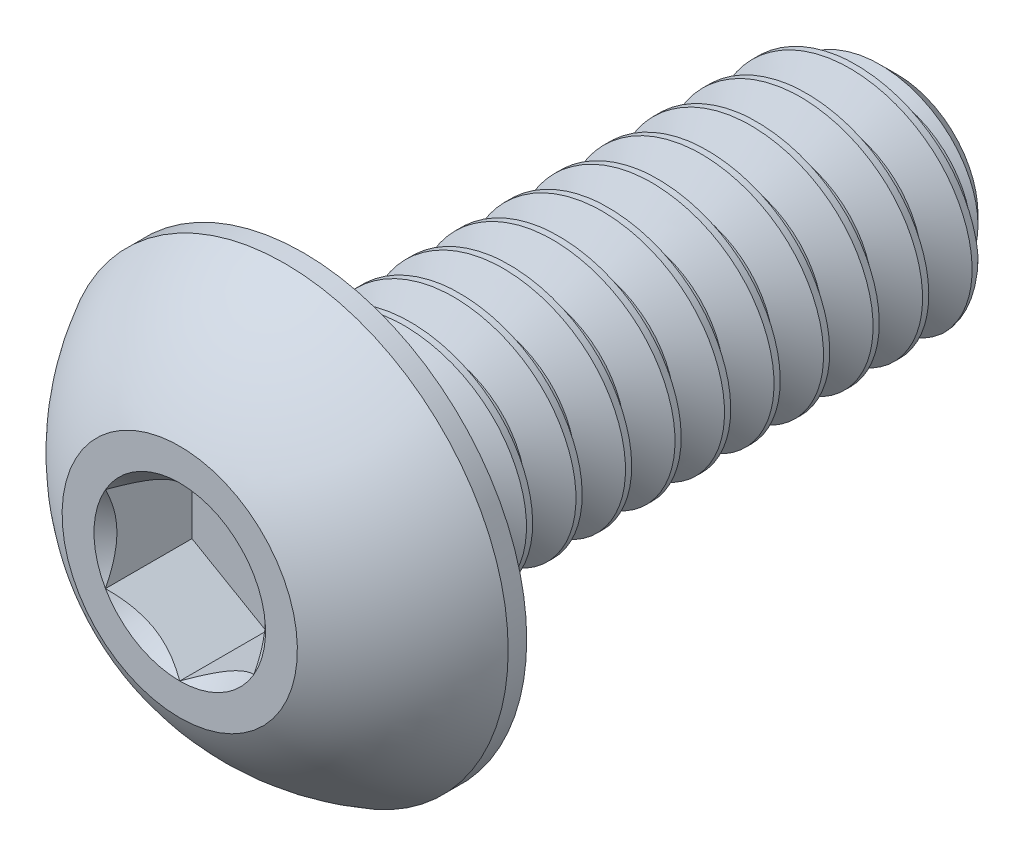
from build123d import *

# Parameters (mm, degrees)
SKETCH1_W          = 6.35
SKETCH1_H          = 1.2573
CHAMFER1_SIZE      = 0.396875
CUT_SWEEP1_PITCH   = 0.529166667
CUT_EXTRUDE2_DEPTH = 0.92456


with BuildPart() as part:
    # Sketch1 → Revolve1 (revolve)
    with BuildSketch(Plane(origin=(0, 0, 0), x_dir=(0, 0, -1), z_dir=(1, 0, 0))):
        with Locations((4.4958, 0.62865)):
            Rectangle(SKETCH1_W, SKETCH1_H)
    revolve(axis=Axis((0, 0, -7.6708), (0, 0, 1)))

    # Chamfer1
    chamfer1_edges = [part.edges().sort_by_distance(p)[0] for p in [
        (0, -1.2573, -7.6708),
    ]]
    chamfer(chamfer1_edges, length=CHAMFER1_SIZE)

    # Cut-Sweep1: the profile of Sketch2 profile screwed along a right-hand helix of 13 turns, 6 arcs to a turn; built about Z, then put on its axis
    cut_sweep1_z = Axis((0, 0, 0), (0, 0, 1))
    cut_sweep1_corners = [(1.2576, 0, 0.000173205), (1.2576, 0, -0.463194038), (0.913596168, 0, -0.264583333), (0.913596168, 0, -0.1984375)]
    with BuildLine(mode=Mode.PRIVATE) as cut_sweep1_profile:
        Line(cut_sweep1_corners[0], cut_sweep1_corners[1])
        Line(cut_sweep1_corners[1], cut_sweep1_corners[2])
        Line(cut_sweep1_corners[2], cut_sweep1_corners[3])
        Line(cut_sweep1_corners[3], cut_sweep1_corners[0])
    cut_sweep1_cap = Face(cut_sweep1_profile.wire())
    cut_sweep1_turn_angles = [0, 30, 60, 90, 120, 150, 180, 210, 240, 270, 300, 330, 360]
    cut_sweep1_turn_weights = [1, 0.8660254037844387, 1, 0.8660254037844387, 1, 0.8660254037844387, 1, 0.8660254037844387, 1, 0.8660254037844387, 1, 0.8660254037844387, 1]
    cut_sweep1_turn_rails = [Edge.make_bspline([Vector(p[0], p[1], 0).rotate(cut_sweep1_z, cut_sweep1_turn_angles[k]) / cut_sweep1_turn_weights[k] + Vector(0, 0, p[2] + CUT_SWEEP1_PITCH * cut_sweep1_turn_angles[k] / 360) for k in range(13)], [0, 0, 0, 1, 1, 2, 2, 3, 3, 4, 4, 5, 5, 6, 6, 6], 2, cut_sweep1_turn_weights) for p in cut_sweep1_corners]
    cut_sweep1_turn_sides = [Face.make_surface_from_curves(cut_sweep1_turn_rails[p[0]], cut_sweep1_turn_rails[p[1]]) for p in [(0, 1), (1, 2), (2, 3), (3, 0)]]
    cut_sweep1 = Plane(origin=(0, 0, -7.6708), x_dir=(0, 1, 0), z_dir=(0, 0, 1)) * Solid(Shell([*[p.moved(Location((0, 0, CUT_SWEEP1_PITCH * i))) for i in range(13) for p in cut_sweep1_turn_sides], cut_sweep1_cap, cut_sweep1_cap.rotate(cut_sweep1_z, 4680).moved(Location((0, 0, CUT_SWEEP1_PITCH * 4680 / 360)))]))
    add(cut_sweep1, mode=Mode.SUBTRACT)

    # Sketch7 → Revolve2 (revolve)
    with BuildSketch(Plane(origin=(0, 0, 0), x_dir=(0, 0, -1), z_dir=(1, 0, 0)), mode=Mode.PRIVATE) as revolve2_sk:
        with BuildLine():
            Line((1.12268, 2.3876), (1.3208, 2.3876))
            Line((1.3208, 2.3876), (1.3208, 0))
            Line((1.3208, 0), (0, 0))
            Line((0, 0), (0, 1.2573))
            ThreePointArc((0, 1.2573), (0.47627484, 1.906941687), (1.12268, 2.3876))
        make_face()
    revolve(revolve2_sk.sketch.rotate(Axis((0, 0, 0), (0, 0, -1)), 189.336081704), axis=Axis((0, 0, 0), (0, 0, -1)))

    # Sketch5 → Cut-Extrude2 (cut)
    with BuildSketch(Plane.XY):
        Polygon((0.79375, -0.458271776), (0.79375, 0.458271776), (0, 0.916543552), (-0.79375, 0.458271776), (-0.79375, -0.458271776), (0, -0.916543552), align=None)
    extrude(amount=-CUT_EXTRUDE2_DEPTH, mode=Mode.SUBTRACT)

    # Cut-Extrude3 cone 1 section (through the dimple's axis) → Cut-Extrude3 (revolve, cut)
    with BuildSketch(Plane(origin=(0, 0, 0), x_dir=(0, -1, 0), z_dir=(1, 0, 0))):
        Polygon((0, 0), (0.916543552, 0), (0, 0.916543552), align=None)
    revolve(axis=Axis((0, 0, 0), (0, 0, -1)), mode=Mode.SUBTRACT)


solid = part.part
